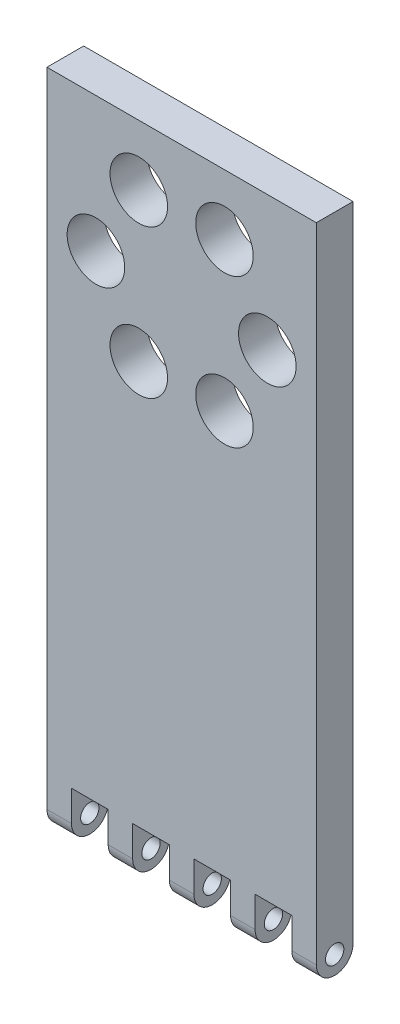
from build123d import *

# Parameters (mm, degrees)
SKETCH1_W              = 44
SKETCH1_H              = 100
BOSS_EXTRUDE1_DEPTH    = 6
SKETCH3_R              = 4.7
CUT_EXTRUDE4_DEPTH     = 10
SKETCH4_W              = 4
SKETCH4_H              = 6
BOSS_EXTRUDE2_DEPTH    = 8
FILLET1_R              = 3
LPATTERN1_COUNT        = 5
LPATTERN1_PITCH        = 10
FILLET1_OF_LPATTERN1_R = 3
SKETCH5_R              = 1.5
CUT_EXTRUDE5_DEPTH     = 74.047929471


with BuildPart() as part:
    # Sketch1 → Boss-Extrude1 (new body)
    with BuildSketch(Plane.XY):
        Rectangle(SKETCH1_W, SKETCH1_H)
    extrude(amount=BOSS_EXTRUDE1_DEPTH)

    # Sketch3 → Cut-Extrude4 (cut)
    with BuildSketch(Plane.XY.offset(6)):
        with Locations((-7.002612265, 40.123358619)):
            Circle(SKETCH3_R)
        with Locations((6.997387735, 40.123358619)):
            Circle(SKETCH3_R)
        with Locations((13.997387735, 27.999002966)):
            Circle(SKETCH3_R)
        with Locations((6.997387735, 15.874647313)):
            Circle(SKETCH3_R)
        with Locations((-7.002612265, 15.874647313)):
            Circle(SKETCH3_R)
        with Locations((-14.002612265, 27.999002966)):
            Circle(SKETCH3_R)
    extrude(amount=-CUT_EXTRUDE4_DEPTH, mode=Mode.SUBTRACT)

    # Sketch4 → Boss-Extrude2 (add)
    with BuildSketch(Plane.XZ.offset(50)):
        with Locations((-20, 3)):
            Rectangle(SKETCH4_W, SKETCH4_H)
    boss_extrude2 = extrude(amount=BOSS_EXTRUDE2_DEPTH)

    # Fillet1
    fillet1_edges = [part.edges().sort_by_distance(p)[0] for p in [
        (-20, -58, 6),
        (-20, -58, 0),
    ]]
    fillet(fillet1_edges, radius=FILLET1_R - 0.0001)  # a hair under: the kernel refuses the full size

    # LPattern1: Boss-Extrude2 ×5
    with Locations(*[(i * LPATTERN1_PITCH, 0, 0) for i in range(1, LPATTERN1_COUNT)]):
        add(boss_extrude2)

    # Fillet1 of LPattern1
    fillet1_of_lpattern1_edges = [part.edges().sort_by_distance(p)[0] for p in [
        (-10, -58, 6),
        (-10, -58, 0),
        (0, -58, 6),
        (0, -58, 0),
        (10, -58, 6),
        (10, -58, 0),
        (20, -58, 6),
        (20, -58, 0),
    ]]
    fillet(fillet1_of_lpattern1_edges, radius=FILLET1_OF_LPATTERN1_R - 0.0001)  # a hair under: the kernel refuses the full size

    # Sketch5 → Cut-Extrude5 (cut, through all)
    with BuildSketch(Plane.ZY.offset(22)):
        with Locations(Location((3, -55, 0), (0, 0, 270))):
            Circle(SKETCH5_R)
    extrude(amount=-CUT_EXTRUDE5_DEPTH, mode=Mode.SUBTRACT)


solid = part.part
